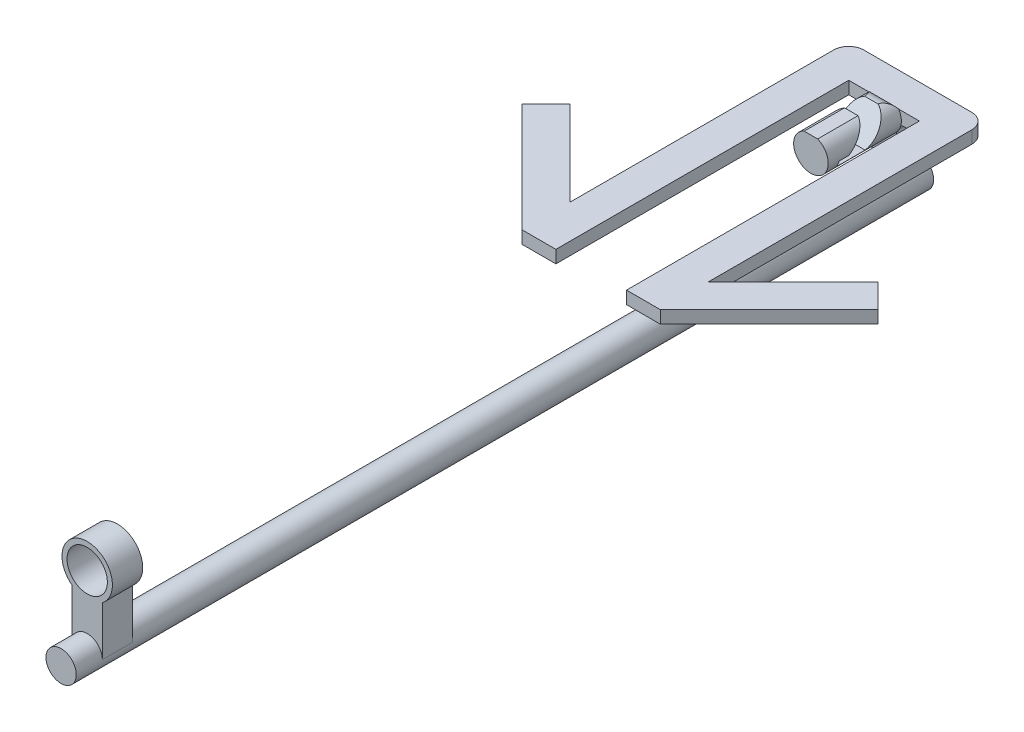
from build123d import *

# Parameters (mm, degrees)
SKETCH1_R               = 3
BOSS_EXTRUDE1_DEPTH     = 170
SKETCH3_W               = 4.850977856
SKETCH3_H               = 6.691139058
BOSS_EXTRUDE2_DEPTH     = 13
SKETCH5_W               = 14
SKETCH5_H               = 6.691139058
BOSS_EXTRUDE4_DEPTH     = 2.5
FILLET1_R               = 1.5
FILLET2_R               = 3
BOSS_EXTRUDE6_DEPTH     = 14.5
FILLET3_R               = 3
CUT_EXTRUDE1_DEPTH      = 4
CUT_EXTRUDE1_DEPTH_BACK = 4.5
SKETCH15_W              = 6
SKETCH15_H              = 5.998501846
BOSS_EXTRUDE7_DEPTH     = 16.843139176
SKETCH16_R              = 5
SKETCH16_R_2            = 4
BOSS_EXTRUDE9_DEPTH     = 5.998501846
CUT_EXTRUDE6_START      = -5.998501846
SKETCH17_R              = 4
CUT_EXTRUDE6_DEPTH      = 5.998501846


with BuildPart() as part:
    # Sketch1 → Boss-Extrude1 (new body)
    with BuildSketch(Plane.XY):
        Circle(SKETCH1_R)
    extrude(amount=BOSS_EXTRUDE1_DEPTH)

    # Sketch3 → Boss-Extrude2 (add)
    with BuildSketch(Plane(origin=(0, 0, 0), x_dir=(1, 0, 0), z_dir=(0, 1, 0))):
        with Locations((0, -3.488992019)):
            Rectangle(SKETCH3_W, SKETCH3_H)
    extrude(amount=BOSS_EXTRUDE2_DEPTH)

    # Sketch5 → Boss-Extrude4 (add)
    with BuildSketch(Plane(origin=(0, 13, 0), x_dir=(1, 0, 0), z_dir=(0, 1, 0))):
        with Locations((0, -3.488992019)):
            Rectangle(SKETCH5_W, SKETCH5_H)
        Polygon((-7, -6.834561548), (-7, -0.14342249), (-13.7, -0.14342249), (-13.7, -55.421203077), (-30.531042429, -38.590160648), (-35.268657863, -43.327776082), (-13.7, -64.896433945), (-7, -64.896433945), align=None)
        Polygon((13.7, -0.14342249), (7, -0.14342249), (7, -6.834561548), (7, -64.896433945), (13.7, -64.896433945), (35.268657863, -43.327776082), (30.531042429, -38.590160648), (13.7, -55.421203077), align=None)
    extrude(amount=BOSS_EXTRUDE4_DEPTH)

    # Fillet1
    fillet1_edges = [part.edges().sort_by_distance(p)[0] for p in [
        (-2.425488928, 13, 3.488992019),
        (2.425488928, 13, 3.488992019),
    ]]
    fillet(fillet1_edges, radius=FILLET1_R)

    # Fillet2
    fillet2_edges = [part.edges().sort_by_distance(p)[0] for p in [
        (13.7, 14.25, 0.14342249),
        (-13.7, 14.25, 0.14342249),
    ]]
    fillet(fillet2_edges, radius=FILLET2_R)

    # Sketch8 → Boss-Extrude6 (add)
    with BuildSketch(Plane.XY.offset(6.834561548)):
        with BuildLine():
            Line((-1.341226683, 16.843139176), (1.341226683, 16.843139176))
            ThreePointArc((1.341226683, 16.843139176), (0, 10.260613318), (-1.341226683, 16.843139176))
        make_face()
    extrude(amount=BOSS_EXTRUDE6_DEPTH)

    # Fillet3
    # the kernel refuses this fillet: 3 mm, written as the material it takes off along each edge
    with BuildSketch(Plane(origin=(-7.593632325, 16.843139176, 6.834561548), x_dir=(0, -1.0, 1.7735276910753176e-12), z_dir=(1, 0, 0))) as fillet3_piece_1:
        with BuildLine():
            CenterArc((3, -2.500962257), FILLET3_R, 123.524048603, 56.475951397)
            Line((0, -2.500962257), (-0.06, -2.500962257))
            Line((-0.06, -2.500962257), (-0.06, 0))
            Line((-0.06, 0), (0, 0.06))
            ThreePointArc((0, 0.06), (0.671569588, 0.06), (1.31000196, 0.050019245))
            Line((1.31000196, 0.050019245), (1.343139176, 0))
        make_face()
    extrude(amount=15.187264651, mode=Mode.SUBTRACT)

    # Sketch14 → Cut-Extrude1 (cut, two sides: drawn at the far end of the back side and taken through both)
    with BuildSketch(Plane(origin=(0, 0, 0), x_dir=(0, 0, -1), z_dir=(1, 0, 0)).offset(-CUT_EXTRUDE1_DEPTH_BACK)):
        Polygon((-9.335523805, 16.843139176), (-13.335523805, 16.843139176), (-17.161439006, 12.918121422), (-19.074284697, 12.918121422), (-19.074284697, 11.627222293), (-13.335523805, 11.627222293), align=None)
    extrude(amount=CUT_EXTRUDE1_DEPTH + CUT_EXTRUDE1_DEPTH_BACK, mode=Mode.SUBTRACT)

    # Sketch15 → Boss-Extrude7 (add)
    with BuildSketch(Plane(origin=(0, 0, 0), x_dir=(1, 0, 0), z_dir=(0, 1, 0))):
        with Locations((0, -161.824268897)):
            Rectangle(SKETCH15_W, SKETCH15_H)
    extrude(amount=BOSS_EXTRUDE7_DEPTH)

    # Sketch16 → Boss-Extrude9 (add)
    with BuildSketch(Plane(origin=(0, 0, 158.825017974), x_dir=(-1, 0, 0), z_dir=(0, 0, -1))):
        with Locations((0, 13.803369952)):
            Circle(SKETCH16_R)
        with Locations((0, 13.803369952)):
            Circle(SKETCH16_R_2, mode=Mode.SUBTRACT)
    extrude(amount=-BOSS_EXTRUDE9_DEPTH)

    # Sketch17 → Cut-Extrude6 (cut)
    with BuildSketch(Plane.XY.offset(164.82351982).offset(CUT_EXTRUDE6_START)):
        with Locations(Location((0, 13.803369952, 0), (0, 0, 180))):
            Circle(SKETCH17_R)
    extrude(amount=CUT_EXTRUDE6_DEPTH, mode=Mode.SUBTRACT)


solid = part.part
